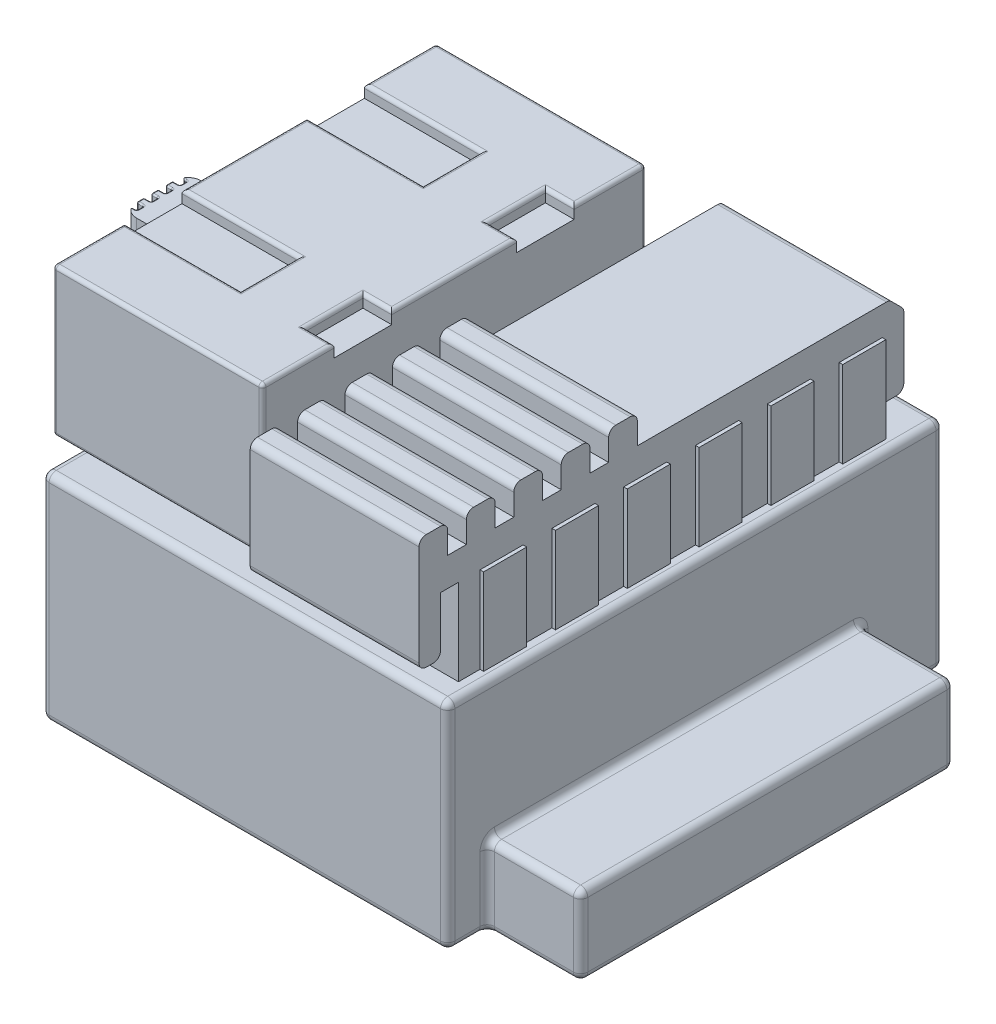
from build123d import *

# Parameters (mm, degrees)
SKETCH1_W           = 28.25
SKETCH1_H           = 34.5
BOSS_EXTRUDE1_DEPTH = 15
SKETCH1_3_W         = 6.5
SKETCH1_3_H         = 26
BOSS_EXTRUDE2_DEPTH = 5.5
SKETCH2_W           = 10.5
SKETCH2_H           = 25
BOSS_EXTRUDE3_DEPTH = 1
SKETCH3_W           = 14.6
SKETCH3_H           = 26.7
BOSS_EXTRUDE4_DEPTH = 10.3
SKETCH4_R           = 0.75
SKETCH4_W           = 9
SKETCH4_H           = 4
CUT_EXTRUDE1_DEPTH  = 2
SKETCH5_W           = 4.5
SKETCH5_H           = 4
BOSS_EXTRUDE5_DEPTH = 6
FILLET1_R           = 1
SKETCH6_W           = 1
SKETCH6_H           = 0.5
CUT_EXTRUDE2_DEPTH  = 6
FILLET4_R           = 0.1
SKETCH7_W           = 8.1
SKETCH7_H           = 4
SKETCH7_W_2         = 2
CUT_EXTRUDE3_DEPTH  = 0.85
FILLET6_R           = 0.25
FILLET7_R           = 0.5
SKETCH8_W           = 12.25
SKETCH8_H           = 3
BOSS_EXTRUDE6_DEPTH = 6
BOSS_EXTRUDE7_DEPTH = 11.75
FILLET8_R           = 0.5


with BuildPart() as part:
    # Sketch1 → Boss-Extrude1 (new body)
    with BuildSketch(Plane(origin=(0, 0, 0), x_dir=(1, 0, 0), z_dir=(0, 1, 0))):
        Rectangle(SKETCH1_W, SKETCH1_H)
    extrude(amount=BOSS_EXTRUDE1_DEPTH)

    # Sketch1<3> → Boss-Extrude2 (add)
    with BuildSketch(Plane(origin=(0, 0, 0), x_dir=(1, 0, 0), z_dir=(0, 1, 0))):
        with Locations((17.375, -1.5)):
            Rectangle(SKETCH1_3_W, SKETCH1_3_H)
    extrude(amount=BOSS_EXTRUDE2_DEPTH)

    # Sketch2 → Boss-Extrude3 (add)
    with BuildSketch(Plane(origin=(0, 15, 0), x_dir=(1, 0, 0), z_dir=(0, 1, 0))):
        with Locations((-6.875, -1.75)):
            Rectangle(SKETCH2_W, SKETCH2_H)
    extrude(amount=BOSS_EXTRUDE3_DEPTH)

    # Sketch3 → Boss-Extrude4 (add)
    with BuildSketch(Plane(origin=(0, 16, 0), x_dir=(1, 0, 0), z_dir=(0, 1, 0))):
        with Locations((-7.575, -2.4)):
            Rectangle(SKETCH3_W, SKETCH3_H)
    extrude(amount=BOSS_EXTRUDE4_DEPTH)

    # Sketch4 → Cut-Extrude1 (cut)
    with BuildSketch(Plane.ZY.offset(14.875)):
        with Locations((-7.45, 21.15)):
            Circle(SKETCH4_R)
        with Locations((12.25, 21.15)):
            Circle(SKETCH4_R)
        with Locations((2.4, 21.15)):
            Rectangle(SKETCH4_W, SKETCH4_H)
    extrude(amount=-CUT_EXTRUDE1_DEPTH, mode=Mode.SUBTRACT)

    # Sketch5 → Boss-Extrude5 (add)
    with BuildSketch(Plane.ZY.offset(12.875)):
        with Locations((4.65, 21.15)):
            Rectangle(SKETCH5_W, SKETCH5_H)
    extrude(amount=BOSS_EXTRUDE5_DEPTH)

    # Fillet1
    fillet1_edges = [part.edges().sort_by_distance(p)[0] for p in [
        (-18.875, 21.15, 6.9),
        (-18.875, 21.15, 2.4),
    ]]
    fillet(fillet1_edges, radius=FILLET1_R)

    # Sketch6 → Cut-Extrude2 (cut)
    with BuildSketch(Plane(origin=(0, 23.15, 0), x_dir=(1, 0, 0), z_dir=(0, 1, 0))):
        with Locations((-18.875, -3.15)):
            Rectangle(SKETCH6_W, SKETCH6_H)
        with Locations((-18.875, -4.15)):
            Rectangle(SKETCH6_W, SKETCH6_H)
        with Locations((-18.875, -5.15)):
            Rectangle(SKETCH6_W, SKETCH6_H)
        with Locations((-18.875, -6.15)):
            Rectangle(SKETCH6_W, SKETCH6_H)
    extrude(amount=-CUT_EXTRUDE2_DEPTH, mode=Mode.SUBTRACT)

    # Fillet4
    fillet4_edges = [part.edges().sort_by_distance(p)[0] for p in [
        (-18.741025404, 21.15, 2.9),
        (-18.375, 19.15, 3.15),
        (-18.375, 21.15, 2.9),
        (-18.558012702, 19.15, 2.9),
        (-18.625, 19.15, 3.4),
        (-18.375, 21.15, 3.4),
        (-18.625, 23.15, 3.4),
        (-18.375, 23.15, 3.15),
        (-18.558012702, 23.15, 2.9),
        (-18.875, 23.15, 3.65),
        (-18.875, 19.15, 4.65),
        (-18.875, 21.15, 4.4),
        (-18.875, 21.15, 3.9),
        (-18.375, 19.15, 4.15),
        (-18.375, 21.15, 3.9),
        (-18.625, 19.15, 3.9),
        (-18.625, 19.15, 4.4),
        (-18.375, 21.15, 4.4),
        (-18.625, 23.15, 3.9),
        (-18.625, 23.15, 4.4),
        (-18.375, 23.15, 4.15),
        (-18.875, 23.15, 4.65),
        (-18.875, 19.15, 5.65),
        (-18.875, 21.15, 5.4),
        (-18.875, 21.15, 4.9),
        (-18.375, 19.15, 5.15),
        (-18.375, 21.15, 4.9),
        (-18.625, 19.15, 4.9),
        (-18.625, 19.15, 5.4),
        (-18.375, 21.15, 5.4),
        (-18.625, 23.15, 4.9),
        (-18.625, 23.15, 5.4),
        (-18.375, 23.15, 5.15),
        (-18.741025404, 21.15, 6.4),
        (-18.375, 19.15, 6.15),
        (-18.375, 21.15, 5.9),
        (-18.625, 19.15, 5.9),
        (-18.558012702, 19.15, 6.4),
        (-18.375, 21.15, 6.4),
        (-18.558012702, 23.15, 6.4),
        (-18.375, 23.15, 6.15),
        (-18.625, 23.15, 5.9),
        (-18.875, 23.15, 5.65),
        (-18.875, 19.15, 3.65),
        (-18.875, 21.15, 5.9),
        (-18.875, 21.15, 3.4),
    ]]
    fillet(fillet4_edges, radius=FILLET4_R)

    # Sketch7 → Cut-Extrude3 (cut)
    with BuildSketch(Plane(origin=(0, 26.3, 0), x_dir=(1, 0, 0), z_dir=(0, 1, 0))):
        with Locations((-10.825, 3.95)):
            Rectangle(SKETCH7_W, SKETCH7_H)
        with Locations((-1.275, 3.95)):
            Rectangle(SKETCH7_W_2, SKETCH7_H)
        with Locations((-10.825, -8.75)):
            Rectangle(SKETCH7_W, SKETCH7_H)
        with Locations((-1.275, -8.75)):
            Rectangle(SKETCH7_W_2, SKETCH7_H)
    extrude(amount=-CUT_EXTRUDE3_DEPTH, mode=Mode.SUBTRACT)

    # Fillet6
    # the kernel refuses this fillet: 0.25 mm, written as the material it takes off along each edge
    with BuildSketch(Plane(origin=(-0.525, 26.05, 15.5), x_dir=(0, 0, 1), z_dir=(1, 0, 0))) as fillet6_piece_1_section:
        Polygon((0, 0), (FILLET6_R, 0), (FILLET6_R, -FILLET6_R), (0, -FILLET6_R), align=None)
    fillet6_piece_1 = extrude(amount=FILLET6_R, mode=Mode.PRIVATE)
    fillet6_piece_1 = fillet6_piece_1 - Plane(origin=(-0.525, 26.05, 15.5), x_dir=(0, -0.7071067811865475, -0.7071067811865475), z_dir=(1, 0, 0)) * Sphere(FILLET6_R, mode=Mode.PRIVATE)
    add(fillet6_piece_1, mode=Mode.SUBTRACT)
    with BuildSketch(Plane(origin=(-14.625, 26.05, 15.5), x_dir=(0, 1, 0), z_dir=(0, 0, 1))) as fillet6_piece_2_section:
        Polygon((0, 0), (FILLET6_R, 0), (FILLET6_R, FILLET6_R), (0, FILLET6_R), align=None)
    fillet6_piece_2 = extrude(amount=FILLET6_R, mode=Mode.PRIVATE)
    fillet6_piece_2 = fillet6_piece_2 - Plane(origin=(-14.625, 26.05, 15.5), x_dir=(0.7071067811865475, -0.7071067811865475, 0), z_dir=(0, 0, 1)) * Sphere(FILLET6_R, mode=Mode.PRIVATE)
    add(fillet6_piece_2, mode=Mode.SUBTRACT)
    with BuildSketch(Plane(origin=(-14.625, 26.05, -10.7), x_dir=(0, 1, 0), z_dir=(0, 0, -1))) as fillet6_piece_3_section:
        Polygon((0, 0), (FILLET6_R, 0), (FILLET6_R, -FILLET6_R), (0, -FILLET6_R), align=None)
    fillet6_piece_3 = extrude(amount=FILLET6_R, mode=Mode.PRIVATE)
    fillet6_piece_3 = fillet6_piece_3 - Plane(origin=(-14.625, 26.05, -10.7), x_dir=(0.7071067811865475, -0.7071067811865475, 0), z_dir=(0, 0, -1)) * Sphere(FILLET6_R, mode=Mode.PRIVATE)
    add(fillet6_piece_3, mode=Mode.SUBTRACT)
    with BuildSketch(Plane(origin=(-0.525, 26.05, -10.7), x_dir=(0, 0, -1), z_dir=(1, 0, 0))) as fillet6_piece_4_section:
        Polygon((0, 0), (FILLET6_R, 0), (FILLET6_R, FILLET6_R), (0, FILLET6_R), align=None)
    fillet6_piece_4 = extrude(amount=FILLET6_R, mode=Mode.PRIVATE)
    fillet6_piece_4 = fillet6_piece_4 - Plane(origin=(-0.525, 26.05, -10.7), x_dir=(0, -0.7071067811865475, 0.7071067811865475), z_dir=(1, 0, 0)) * Sphere(FILLET6_R, mode=Mode.PRIVATE)
    add(fillet6_piece_4, mode=Mode.SUBTRACT)
    with BuildSketch(Plane(origin=(-0.525, 16.25, -10.7), x_dir=(0, 0, -1), z_dir=(0, -1, 0))) as fillet6_piece_5_section:
        Polygon((0, 0), (FILLET6_R, 0), (FILLET6_R, FILLET6_R), (0, FILLET6_R), align=None)
    fillet6_piece_5 = extrude(amount=FILLET6_R, mode=Mode.PRIVATE)
    fillet6_piece_5 = fillet6_piece_5 - Plane(origin=(-0.525, 16.25, -10.7), x_dir=(-0.7071067811865475, 0, 0.7071067811865477), z_dir=(0, -1, 0)) * Sphere(FILLET6_R, mode=Mode.PRIVATE)
    add(fillet6_piece_5, mode=Mode.SUBTRACT)
    with BuildSketch(Plane(origin=(-14.625, 16.25, -10.7), x_dir=(0, 0, -1), z_dir=(0, -1, 0))) as fillet6_piece_6_section:
        Polygon((0, 0), (FILLET6_R, 0), (FILLET6_R, -FILLET6_R), (0, -FILLET6_R), align=None)
    fillet6_piece_6 = extrude(amount=FILLET6_R, mode=Mode.PRIVATE)
    fillet6_piece_6 = fillet6_piece_6 - Plane(origin=(-14.625, 16.25, -10.7), x_dir=(0.7071067811865476, 0, 0.7071067811865475), z_dir=(0, -1, 0)) * Sphere(FILLET6_R, mode=Mode.PRIVATE)
    add(fillet6_piece_6, mode=Mode.SUBTRACT)
    with BuildSketch(Plane(origin=(-14.625, 16.25, 15.5), x_dir=(0, 0, 1), z_dir=(0, -1, 0))) as fillet6_piece_7_section:
        Polygon((0, 0), (FILLET6_R, 0), (FILLET6_R, FILLET6_R), (0, FILLET6_R), align=None)
    fillet6_piece_7 = extrude(amount=FILLET6_R, mode=Mode.PRIVATE)
    fillet6_piece_7 = fillet6_piece_7 - Plane(origin=(-14.625, 16.25, 15.5), x_dir=(0.7071067811865475, 0, -0.7071067811865477), z_dir=(0, -1, 0)) * Sphere(FILLET6_R, mode=Mode.PRIVATE)
    add(fillet6_piece_7, mode=Mode.SUBTRACT)
    with BuildSketch(Plane(origin=(-0.525, 16.25, 15.5), x_dir=(0, 0, 1), z_dir=(0, -1, 0))) as fillet6_piece_8_section:
        Polygon((0, 0), (FILLET6_R, 0), (FILLET6_R, -FILLET6_R), (0, -FILLET6_R), align=None)
    fillet6_piece_8 = extrude(amount=FILLET6_R, mode=Mode.PRIVATE)
    fillet6_piece_8 = fillet6_piece_8 - Plane(origin=(-0.525, 16.25, 15.5), x_dir=(-0.7071067811865476, 0, -0.7071067811865475), z_dir=(0, -1, 0)) * Sphere(FILLET6_R, mode=Mode.PRIVATE)
    add(fillet6_piece_8, mode=Mode.SUBTRACT)
    with BuildSketch(Plane(origin=(-0.275, 26.3, 10.125), x_dir=(-1, 0, 0), z_dir=(0, 0, 1)), Plane(origin=(-0.275, 26.3, -10.7), x_dir=(-1, 0, 0), z_dir=(0, 0, 1))) as fillet6_piece_9:
        with BuildLine():
            CenterArc((FILLET6_R, FILLET6_R), FILLET6_R, 180, 90)
            Line((0, FILLET6_R), (0, 0))
            Line((0, 0), (FILLET6_R, 0))
        make_face()
    extrude(amount=5.375, mode=Mode.SUBTRACT)
    with BuildSketch(Plane(origin=(-0.525, 26.3, 15.75), x_dir=(0, 0, -1), z_dir=(-1, 0, 0))) as fillet6_piece_10:
        with BuildLine():
            CenterArc((FILLET6_R, FILLET6_R), FILLET6_R, 180, 90)
            Line((0, FILLET6_R), (0, 0))
            Line((0, 0), (FILLET6_R, 0))
        make_face()
    extrude(amount=14.1, mode=Mode.SUBTRACT)
    with BuildSketch(Plane(origin=(-14.875, 26.3, 15.5), x_dir=(0, -1, 0), z_dir=(0, 0, -1)), Plane(origin=(-14.875, 26.3, -5.325), x_dir=(0, -1, 0), z_dir=(0, 0, -1))) as fillet6_piece_11:
        with BuildLine():
            CenterArc((FILLET6_R, -FILLET6_R), FILLET6_R, 90, 90)
            Line((0, -FILLET6_R), (0, 0))
            Line((0, 0), (FILLET6_R, 0))
        make_face()
    extrude(amount=5.375, mode=Mode.SUBTRACT)
    with BuildSketch(Plane(origin=(-6.775, 26.3, 10.75), x_dir=(0, 0, 1), z_dir=(-1, 0, 0)), Plane(origin=(-15.5, 26.3, 6.75), x_dir=(0, 0, -1), z_dir=(1, 0, 0)), Plane(origin=(-6.775, 26.3, -1.95), x_dir=(0, 0, 1), z_dir=(-1, 0, 0)), Plane(origin=(-15.5, 26.3, -5.95), x_dir=(0, 0, -1), z_dir=(1, 0, 0))) as fillet6_piece_12:
        with BuildLine():
            CenterArc((FILLET6_R, -FILLET6_R), FILLET6_R, 90, 90)
            Line((0, -FILLET6_R), (0, 0))
            Line((0, 0), (FILLET6_R, 0))
        make_face()
    extrude(amount=8.725, mode=Mode.SUBTRACT)
    with BuildSketch(Plane(origin=(-6.775, 26.3, 6.75), x_dir=(1, 0, 0), z_dir=(0, 0, 1)), Plane(origin=(-6.775, 26.3, -5.95), x_dir=(1, 0, 0), z_dir=(0, 0, 1)), Plane(origin=(-2.275, 26.3, -1.95), x_dir=(-1, 0, 0), z_dir=(0, 0, -1)), Plane(origin=(-2.275, 26.3, 10.75), x_dir=(-1, 0, 0), z_dir=(0, 0, -1))) as fillet6_piece_13:
        with BuildLine():
            CenterArc((FILLET6_R, -FILLET6_R), FILLET6_R, 90, 90)
            Line((0, -FILLET6_R), (0, 0))
            Line((0, 0), (FILLET6_R, 0))
        make_face()
    extrude(amount=4, mode=Mode.SUBTRACT)
    with BuildSketch(Plane(origin=(-14.875, 26.3, 7.375), x_dir=(0, -1, 0), z_dir=(0, 0, -1))) as fillet6_piece_14:
        with BuildLine():
            CenterArc((FILLET6_R, -FILLET6_R), FILLET6_R, 90, 90)
            Line((0, -FILLET6_R), (0, 0))
            Line((0, 0), (FILLET6_R, 0))
        make_face()
    extrude(amount=9.95, mode=Mode.SUBTRACT)
    with BuildSketch(Plane(origin=(-14.625, 26.3, -10.95), x_dir=(0, -1, 0), z_dir=(1, 0, 0)), Plane(origin=(-0.525, 16, 15.75), x_dir=(0, 0, -1), z_dir=(-1, 0, 0))) as fillet6_piece_15:
        with BuildLine():
            CenterArc((FILLET6_R, -FILLET6_R), FILLET6_R, 90, 90)
            Line((0, -FILLET6_R), (0, 0))
            Line((0, 0), (FILLET6_R, 0))
        make_face()
    extrude(amount=14.1, mode=Mode.SUBTRACT)
    with BuildSketch(Plane(origin=(-2.275, 26.3, -5.95), x_dir=(0, 0, -1), z_dir=(1, 0, 0)), Plane(origin=(0.35, 26.3, -1.95), x_dir=(0, 0, 1), z_dir=(-1, 0, 0)), Plane(origin=(-2.275, 26.3, 6.75), x_dir=(0, 0, -1), z_dir=(1, 0, 0)), Plane(origin=(0.35, 26.3, 10.75), x_dir=(0, 0, 1), z_dir=(-1, 0, 0))) as fillet6_piece_16:
        with BuildLine():
            CenterArc((FILLET6_R, -FILLET6_R), FILLET6_R, 90, 90)
            Line((0, -FILLET6_R), (0, 0))
            Line((0, 0), (FILLET6_R, 0))
        make_face()
    extrude(amount=2.625, mode=Mode.SUBTRACT)
    with BuildSketch(Plane(origin=(-0.275, 26.3, -2.575), x_dir=(-1, 0, 0), z_dir=(0, 0, 1))) as fillet6_piece_17:
        with BuildLine():
            CenterArc((FILLET6_R, FILLET6_R), FILLET6_R, 180, 90)
            Line((0, FILLET6_R), (0, 0))
            Line((0, 0), (FILLET6_R, 0))
        make_face()
    extrude(amount=9.95, mode=Mode.SUBTRACT)
    with BuildSketch(Plane(origin=(-0.275, 16.25, -10.95), x_dir=(-1, 0, 0), z_dir=(0, 1, 0)), Plane(origin=(-14.875, 16.25, -10.95), x_dir=(0, 0, 1), z_dir=(0, 1, 0))) as fillet6_piece_18:
        with BuildLine():
            CenterArc((FILLET6_R, FILLET6_R), FILLET6_R, 180, 90)
            Line((0, FILLET6_R), (0, 0))
            Line((0, 0), (FILLET6_R, 0))
        make_face()
    extrude(amount=9.8, mode=Mode.SUBTRACT)
    with BuildSketch(Plane(origin=(-14.875, 16.25, 15.75), x_dir=(0, 0, -1), z_dir=(0, 1, 0)), Plane(origin=(-0.275, 16.25, 15.75), x_dir=(-1, 0, 0), z_dir=(0, 1, 0))) as fillet6_piece_19:
        with BuildLine():
            CenterArc((FILLET6_R, -FILLET6_R), FILLET6_R, 90, 90)
            Line((0, -FILLET6_R), (0, 0))
            Line((0, 0), (FILLET6_R, 0))
        make_face()
    extrude(amount=9.8, mode=Mode.SUBTRACT)
    with BuildSketch(Plane(origin=(-0.275, 16, -10.7), x_dir=(-1, 0, 0), z_dir=(0, 0, 1))) as fillet6_piece_20:
        with BuildLine():
            CenterArc((FILLET6_R, -FILLET6_R), FILLET6_R, 90, 90)
            Line((0, -FILLET6_R), (0, 0))
            Line((0, 0), (FILLET6_R, 0))
        make_face()
    extrude(amount=26.2, mode=Mode.SUBTRACT)
    with BuildSketch(Plane(origin=(-14.625, 16, -10.95), x_dir=(0, 0, 1), z_dir=(1, 0, 0))) as fillet6_piece_21_section:
        with BuildLine():
            CenterArc((FILLET6_R, -FILLET6_R), FILLET6_R, 90, 90)
            Line((0, -FILLET6_R), (0, 0))
            Line((0, 0), (FILLET6_R, 0))
        make_face()
    fillet6_piece_21 = extrude(amount=14.1, mode=Mode.PRIVATE)
    fillet6_piece_21 = split(fillet6_piece_21, bisect_by=Plane(origin=(-12.125, 15.998507735, -10.728145623), z_dir=(-1, 0, 0)), keep=Keep.TOP, mode=Mode.PRIVATE)
    fillet6_piece_21 = split(fillet6_piece_21, bisect_by=Plane(origin=(-13.375, 15.998507735, -10.75), z_dir=(0, 0, 1)), keep=Keep.TOP, mode=Mode.PRIVATE)
    add(fillet6_piece_21, mode=Mode.SUBTRACT)
    with BuildSketch(Plane(origin=(-14.625, 16, -10.95), x_dir=(0, 0, 1), z_dir=(1, 0, 0))) as fillet6_piece_22_section:
        with BuildLine():
            CenterArc((FILLET6_R, -FILLET6_R), FILLET6_R, 90, 90)
            Line((0, -FILLET6_R), (0, 0))
            Line((0, 0), (FILLET6_R, 0))
        make_face()
    fillet6_piece_22 = extrude(amount=14.1, mode=Mode.PRIVATE)
    fillet6_piece_22 = split(fillet6_piece_22, bisect_by=Plane(origin=(-12.125, 16.057841629, -10.896936842), z_dir=(-1, 0, 0)), keep=Keep.TOP, mode=Mode.PRIVATE)
    fillet6_piece_22 = split(fillet6_piece_22, bisect_by=Plane(origin=(-13.375, 16.057841629, -10.75), z_dir=(0, 0, -1)), keep=Keep.TOP, mode=Mode.PRIVATE)
    add(fillet6_piece_22, mode=Mode.SUBTRACT)
    with BuildSketch(Plane(origin=(-14.625, 16, -10.95), x_dir=(0, 0, 1), z_dir=(1, 0, 0))) as fillet6_piece_23_section:
        with BuildLine():
            CenterArc((FILLET6_R, -FILLET6_R), FILLET6_R, 90, 90)
            Line((0, -FILLET6_R), (0, 0))
            Line((0, 0), (FILLET6_R, 0))
        make_face()
    fillet6_piece_23 = extrude(amount=14.1, mode=Mode.PRIVATE)
    fillet6_piece_23 = split(fillet6_piece_23, bisect_by=Plane(origin=(-12.125, 16.057841629, -10.896936842), z_dir=(1, 0, 0)), keep=Keep.TOP, mode=Mode.PRIVATE)
    fillet6_piece_23 = split(fillet6_piece_23, bisect_by=Plane(origin=(-6.875, 16.057841629, -10.75), z_dir=(0, 0, -1)), keep=Keep.TOP, mode=Mode.PRIVATE)
    fillet6_piece_23 = split(fillet6_piece_23, bisect_by=Plane(origin=(-1.625, 16.057841629, -10.896936842), z_dir=(-1, 0, 0)), keep=Keep.TOP, mode=Mode.PRIVATE)
    add(fillet6_piece_23, mode=Mode.SUBTRACT)
    with BuildSketch(Plane(origin=(-14.625, 16, -10.95), x_dir=(0, 0, 1), z_dir=(1, 0, 0))) as fillet6_piece_24_section:
        with BuildLine():
            CenterArc((FILLET6_R, -FILLET6_R), FILLET6_R, 90, 90)
            Line((0, -FILLET6_R), (0, 0))
            Line((0, 0), (FILLET6_R, 0))
        make_face()
    fillet6_piece_24 = extrude(amount=14.1, mode=Mode.PRIVATE)
    fillet6_piece_24 = split(fillet6_piece_24, bisect_by=Plane(origin=(-1.075, 15.998507735, -10.75), z_dir=(0, 0, 1)), keep=Keep.TOP, mode=Mode.PRIVATE)
    fillet6_piece_24 = split(fillet6_piece_24, bisect_by=Plane(origin=(-1.625, 15.998507735, -10.728145623), z_dir=(1, 0, 0)), keep=Keep.TOP, mode=Mode.PRIVATE)
    add(fillet6_piece_24, mode=Mode.SUBTRACT)
    with BuildSketch(Plane(origin=(-14.625, 16, -10.95), x_dir=(0, 0, 1), z_dir=(1, 0, 0))) as fillet6_piece_25_section:
        with BuildLine():
            CenterArc((FILLET6_R, -FILLET6_R), FILLET6_R, 90, 90)
            Line((0, -FILLET6_R), (0, 0))
            Line((0, 0), (FILLET6_R, 0))
        make_face()
    fillet6_piece_25 = extrude(amount=14.1, mode=Mode.PRIVATE)
    fillet6_piece_25 = split(fillet6_piece_25, bisect_by=Plane(origin=(-1.075, 16.057841629, -10.75), z_dir=(0, 0, -1)), keep=Keep.TOP, mode=Mode.PRIVATE)
    fillet6_piece_25 = split(fillet6_piece_25, bisect_by=Plane(origin=(-1.625, 16.057841629, -10.896936842), z_dir=(1, 0, 0)), keep=Keep.TOP, mode=Mode.PRIVATE)
    add(fillet6_piece_25, mode=Mode.SUBTRACT)
    with BuildSketch(Plane(origin=(-14.875, 16, 15.5), x_dir=(0, 1, 0), z_dir=(0, 0, -1))) as fillet6_piece_26:
        with BuildLine():
            CenterArc((FILLET6_R, FILLET6_R), FILLET6_R, 180, 90)
            Line((0, FILLET6_R), (0, 0))
            Line((0, 0), (FILLET6_R, 0))
        make_face()
    extrude(amount=26.2, mode=Mode.SUBTRACT)
    with BuildSketch(Plane(origin=(-6.775, 26.3, 6.75), x_dir=(1, 0, 0), z_dir=(0, 0, 1))) as fillet6_piece_27a_section:
        with BuildLine():
            CenterArc((FILLET6_R, -FILLET6_R), FILLET6_R, 90, 90)
            Line((0, -FILLET6_R), (0, 0))
            Line((0, 0), (FILLET6_R, 0))
        make_face()
    fillet6_piece_27a = extrude(amount=4.625, mode=Mode.PRIVATE)
    fillet6_piece_27a = split(fillet6_piece_27a, bisect_by=Plane(origin=(-6.718401221, 26.243401221, 10.75), z_dir=(0, 0, 1)), keep=Keep.TOP, mode=Mode.PRIVATE)
    with BuildSketch(Plane(origin=(-6.15, 26.3, 10.75), x_dir=(0, 0, 1), z_dir=(-1, 0, 0))) as fillet6_piece_27b_section:
        with BuildLine():
            CenterArc((FILLET6_R, -FILLET6_R), FILLET6_R, 90, 90)
            Line((0, -FILLET6_R), (0, 0))
            Line((0, 0), (FILLET6_R, 0))
        make_face()
    fillet6_piece_27b = extrude(amount=9.35, mode=Mode.PRIVATE)
    fillet6_piece_27b = split(fillet6_piece_27b, bisect_by=Plane(origin=(-6.775, 26.243401221, 10.806598779), z_dir=(1, 0, 0)), keep=Keep.TOP, mode=Mode.PRIVATE)
    fillet6_piece_27 = fillet6_piece_27a & fillet6_piece_27b
    add(fillet6_piece_27, mode=Mode.SUBTRACT)
    with BuildSketch(Plane(origin=(-15.5, 26.3, 6.75), x_dir=(0, 0, -1), z_dir=(1, 0, 0))) as fillet6_piece_28a_section:
        with BuildLine():
            CenterArc((FILLET6_R, -FILLET6_R), FILLET6_R, 90, 90)
            Line((0, -FILLET6_R), (0, 0))
            Line((0, 0), (FILLET6_R, 0))
        make_face()
    fillet6_piece_28a = extrude(amount=9.35, mode=Mode.PRIVATE)
    fillet6_piece_28a = split(fillet6_piece_28a, bisect_by=Plane(origin=(-6.775, 26.243401221, 6.693401221), z_dir=(1, 0, 0)), keep=Keep.TOP, mode=Mode.PRIVATE)
    with BuildSketch(Plane(origin=(-6.775, 26.3, 6.125), x_dir=(1, 0, 0), z_dir=(0, 0, 1))) as fillet6_piece_28b_section:
        with BuildLine():
            CenterArc((FILLET6_R, -FILLET6_R), FILLET6_R, 90, 90)
            Line((0, -FILLET6_R), (0, 0))
            Line((0, 0), (FILLET6_R, 0))
        make_face()
    fillet6_piece_28b = extrude(amount=4.625, mode=Mode.PRIVATE)
    fillet6_piece_28b = split(fillet6_piece_28b, bisect_by=Plane(origin=(-6.718401221, 26.243401221, 6.75), z_dir=(0, 0, -1)), keep=Keep.TOP, mode=Mode.PRIVATE)
    fillet6_piece_28 = fillet6_piece_28a & fillet6_piece_28b
    add(fillet6_piece_28, mode=Mode.SUBTRACT)
    with BuildSketch(Plane(origin=(-6.775, 26.3, -5.95), x_dir=(1, 0, 0), z_dir=(0, 0, 1))) as fillet6_piece_29a_section:
        with BuildLine():
            CenterArc((FILLET6_R, -FILLET6_R), FILLET6_R, 90, 90)
            Line((0, -FILLET6_R), (0, 0))
            Line((0, 0), (FILLET6_R, 0))
        make_face()
    fillet6_piece_29a = extrude(amount=4.625, mode=Mode.PRIVATE)
    fillet6_piece_29a = split(fillet6_piece_29a, bisect_by=Plane(origin=(-6.718401221, 26.243401221, -1.95), z_dir=(0, 0, 1)), keep=Keep.TOP, mode=Mode.PRIVATE)
    with BuildSketch(Plane(origin=(-6.15, 26.3, -1.95), x_dir=(0, 0, 1), z_dir=(-1, 0, 0))) as fillet6_piece_29b_section:
        with BuildLine():
            CenterArc((FILLET6_R, -FILLET6_R), FILLET6_R, 90, 90)
            Line((0, -FILLET6_R), (0, 0))
            Line((0, 0), (FILLET6_R, 0))
        make_face()
    fillet6_piece_29b = extrude(amount=9.35, mode=Mode.PRIVATE)
    fillet6_piece_29b = split(fillet6_piece_29b, bisect_by=Plane(origin=(-6.775, 26.243401221, -1.893401221), z_dir=(1, 0, 0)), keep=Keep.TOP, mode=Mode.PRIVATE)
    fillet6_piece_29 = fillet6_piece_29a & fillet6_piece_29b
    add(fillet6_piece_29, mode=Mode.SUBTRACT)
    with BuildSketch(Plane(origin=(-15.5, 26.3, -5.95), x_dir=(0, 0, -1), z_dir=(1, 0, 0))) as fillet6_piece_30a_section:
        with BuildLine():
            CenterArc((FILLET6_R, -FILLET6_R), FILLET6_R, 90, 90)
            Line((0, -FILLET6_R), (0, 0))
            Line((0, 0), (FILLET6_R, 0))
        make_face()
    fillet6_piece_30a = extrude(amount=9.35, mode=Mode.PRIVATE)
    fillet6_piece_30a = split(fillet6_piece_30a, bisect_by=Plane(origin=(-6.775, 26.243401221, -6.006598779), z_dir=(1, 0, 0)), keep=Keep.TOP, mode=Mode.PRIVATE)
    with BuildSketch(Plane(origin=(-6.775, 26.3, -6.575), x_dir=(1, 0, 0), z_dir=(0, 0, 1))) as fillet6_piece_30b_section:
        with BuildLine():
            CenterArc((FILLET6_R, -FILLET6_R), FILLET6_R, 90, 90)
            Line((0, -FILLET6_R), (0, 0))
            Line((0, 0), (FILLET6_R, 0))
        make_face()
    fillet6_piece_30b = extrude(amount=4.625, mode=Mode.PRIVATE)
    fillet6_piece_30b = split(fillet6_piece_30b, bisect_by=Plane(origin=(-6.718401221, 26.243401221, -5.95), z_dir=(0, 0, -1)), keep=Keep.TOP, mode=Mode.PRIVATE)
    fillet6_piece_30 = fillet6_piece_30a & fillet6_piece_30b
    add(fillet6_piece_30, mode=Mode.SUBTRACT)
    with BuildSketch(Plane(origin=(-2.275, 26.3, -1.95), x_dir=(-1, 0, 0), z_dir=(0, 0, -1))) as fillet6_piece_31a_section:
        with BuildLine():
            CenterArc((FILLET6_R, -FILLET6_R), FILLET6_R, 90, 90)
            Line((0, -FILLET6_R), (0, 0))
            Line((0, 0), (FILLET6_R, 0))
        make_face()
    fillet6_piece_31a = extrude(amount=4.625, mode=Mode.PRIVATE)
    fillet6_piece_31a = split(fillet6_piece_31a, bisect_by=Plane(origin=(-2.331598779, 26.243401221, -5.95), z_dir=(0, 0, -1)), keep=Keep.TOP, mode=Mode.PRIVATE)
    with BuildSketch(Plane(origin=(-2.9, 26.3, -5.95), x_dir=(0, 0, -1), z_dir=(1, 0, 0))) as fillet6_piece_31b_section:
        with BuildLine():
            CenterArc((FILLET6_R, -FILLET6_R), FILLET6_R, 90, 90)
            Line((0, -FILLET6_R), (0, 0))
            Line((0, 0), (FILLET6_R, 0))
        make_face()
    fillet6_piece_31b = extrude(amount=3.25, mode=Mode.PRIVATE)
    fillet6_piece_31b = split(fillet6_piece_31b, bisect_by=Plane(origin=(-2.275, 26.243401221, -6.006598779), z_dir=(-1, 0, 0)), keep=Keep.TOP, mode=Mode.PRIVATE)
    fillet6_piece_31 = fillet6_piece_31a & fillet6_piece_31b
    add(fillet6_piece_31, mode=Mode.SUBTRACT)
    with BuildSketch(Plane(origin=(0.35, 26.3, -1.95), x_dir=(0, 0, 1), z_dir=(-1, 0, 0))) as fillet6_piece_32a_section:
        with BuildLine():
            CenterArc((FILLET6_R, -FILLET6_R), FILLET6_R, 90, 90)
            Line((0, -FILLET6_R), (0, 0))
            Line((0, 0), (FILLET6_R, 0))
        make_face()
    fillet6_piece_32a = extrude(amount=3.25, mode=Mode.PRIVATE)
    fillet6_piece_32a = split(fillet6_piece_32a, bisect_by=Plane(origin=(-2.275, 26.243401221, -1.893401221), z_dir=(-1, 0, 0)), keep=Keep.TOP, mode=Mode.PRIVATE)
    with BuildSketch(Plane(origin=(-2.275, 26.3, -1.325), x_dir=(-1, 0, 0), z_dir=(0, 0, -1))) as fillet6_piece_32b_section:
        with BuildLine():
            CenterArc((FILLET6_R, -FILLET6_R), FILLET6_R, 90, 90)
            Line((0, -FILLET6_R), (0, 0))
            Line((0, 0), (FILLET6_R, 0))
        make_face()
    fillet6_piece_32b = extrude(amount=4.625, mode=Mode.PRIVATE)
    fillet6_piece_32b = split(fillet6_piece_32b, bisect_by=Plane(origin=(-2.331598779, 26.243401221, -1.95), z_dir=(0, 0, 1)), keep=Keep.TOP, mode=Mode.PRIVATE)
    fillet6_piece_32 = fillet6_piece_32a & fillet6_piece_32b
    add(fillet6_piece_32, mode=Mode.SUBTRACT)
    with BuildSketch(Plane(origin=(-2.275, 26.3, 10.75), x_dir=(-1, 0, 0), z_dir=(0, 0, -1))) as fillet6_piece_33a_section:
        with BuildLine():
            CenterArc((FILLET6_R, -FILLET6_R), FILLET6_R, 90, 90)
            Line((0, -FILLET6_R), (0, 0))
            Line((0, 0), (FILLET6_R, 0))
        make_face()
    fillet6_piece_33a = extrude(amount=4.625, mode=Mode.PRIVATE)
    fillet6_piece_33a = split(fillet6_piece_33a, bisect_by=Plane(origin=(-2.331598779, 26.243401221, 6.75), z_dir=(0, 0, -1)), keep=Keep.TOP, mode=Mode.PRIVATE)
    with BuildSketch(Plane(origin=(-2.9, 26.3, 6.75), x_dir=(0, 0, -1), z_dir=(1, 0, 0))) as fillet6_piece_33b_section:
        with BuildLine():
            CenterArc((FILLET6_R, -FILLET6_R), FILLET6_R, 90, 90)
            Line((0, -FILLET6_R), (0, 0))
            Line((0, 0), (FILLET6_R, 0))
        make_face()
    fillet6_piece_33b = extrude(amount=3.25, mode=Mode.PRIVATE)
    fillet6_piece_33b = split(fillet6_piece_33b, bisect_by=Plane(origin=(-2.275, 26.243401221, 6.693401221), z_dir=(-1, 0, 0)), keep=Keep.TOP, mode=Mode.PRIVATE)
    fillet6_piece_33 = fillet6_piece_33a & fillet6_piece_33b
    add(fillet6_piece_33, mode=Mode.SUBTRACT)
    with BuildSketch(Plane(origin=(0.35, 26.3, 10.75), x_dir=(0, 0, 1), z_dir=(-1, 0, 0))) as fillet6_piece_34a_section:
        with BuildLine():
            CenterArc((FILLET6_R, -FILLET6_R), FILLET6_R, 90, 90)
            Line((0, -FILLET6_R), (0, 0))
            Line((0, 0), (FILLET6_R, 0))
        make_face()
    fillet6_piece_34a = extrude(amount=3.25, mode=Mode.PRIVATE)
    fillet6_piece_34a = split(fillet6_piece_34a, bisect_by=Plane(origin=(-2.275, 26.243401221, 10.806598779), z_dir=(-1, 0, 0)), keep=Keep.TOP, mode=Mode.PRIVATE)
    with BuildSketch(Plane(origin=(-2.275, 26.3, 11.375), x_dir=(-1, 0, 0), z_dir=(0, 0, -1))) as fillet6_piece_34b_section:
        with BuildLine():
            CenterArc((FILLET6_R, -FILLET6_R), FILLET6_R, 90, 90)
            Line((0, -FILLET6_R), (0, 0))
            Line((0, 0), (FILLET6_R, 0))
        make_face()
    fillet6_piece_34b = extrude(amount=4.625, mode=Mode.PRIVATE)
    fillet6_piece_34b = split(fillet6_piece_34b, bisect_by=Plane(origin=(-2.331598779, 26.243401221, 10.75), z_dir=(0, 0, 1)), keep=Keep.TOP, mode=Mode.PRIVATE)
    fillet6_piece_34 = fillet6_piece_34a & fillet6_piece_34b
    add(fillet6_piece_34, mode=Mode.SUBTRACT)

    # Fillet7
    fillet7_edges = [part.edges().sort_by_distance(p)[0] for p in [
        (0, 15, -17.25),
        (14.125, 0, -14.375),
        (20.625, 5.5, 1.5),
        (20.625, 2.75, 14.5),
        (17.375, 5.5, -11.5),
        (20.625, 2.75, -11.5),
        (14.125, 5.5, 1.5),
        (-14.125, 15, 0),
        (14.125, 2.75, -11.5),
        (17.375, 0, 14.5),
        (14.125, 2.75, 14.5),
        (17.375, 5.5, 14.5),
        (20.625, 0, 1.5),
        (17.375, 0, -11.5),
        (0, 15, 17.25),
        (-14.125, 0, 0),
        (0, 0, -17.25),
        (14.125, 0, 15.875),
        (0, 0, 17.25),
        (-14.125, 7.5, 17.25),
        (-14.125, 7.5, -17.25),
        (14.125, 7.5, -17.25),
        (14.125, 15, 0),
        (14.125, 7.5, 17.25),
    ]]
    fillet(fillet7_edges, radius=FILLET7_R)

    # Sketch8 → Boss-Extrude6 (add)
    with BuildSketch(Plane(origin=(0, 15, 0), x_dir=(1, 0, 0), z_dir=(0, 1, 0))):
        with Locations((7.25, 12.5)):
            Rectangle(SKETCH8_W, SKETCH8_H)
        with Locations((7.25, 7.5)):
            Rectangle(SKETCH8_W, SKETCH8_H)
        with Locations((7.25, 2.5)):
            Rectangle(SKETCH8_W, SKETCH8_H)
        with Locations((7.25, -2.5)):
            Rectangle(SKETCH8_W, SKETCH8_H)
        with Locations((7.25, -7.5)):
            Rectangle(SKETCH8_W, SKETCH8_H)
        with Locations((7.25, -12.5)):
            Rectangle(SKETCH8_W, SKETCH8_H)
    extrude(amount=BOSS_EXTRUDE6_DEPTH)

    # Sketch9 → Boss-Extrude7 (add)
    with BuildSketch(Plane(origin=(13.125, 0, 0), x_dir=(0, 0, -1), z_dir=(1, 0, 0))):
        Polygon((-14, 15), (-14, 21), (-11, 21), (-11, 15), (-9, 15), (-9, 21), (-6, 21), (-6, 15), (-4, 15), (-4, 21), (-1, 21), (-1, 15), (1, 15), (1, 21), (4, 21), (4, 15), (6, 15), (6, 21), (9, 21), (9, 15), (11, 15), (11, 21), (14, 21), (14, 17), (15.5, 17), (15.5, 22), (14.5, 23), (-3.05, 23), (-3.05, 25), (-5.05, 25), (-5.05, 23), (-6.35, 23), (-6.35, 25), (-8.35, 25), (-8.35, 23), (-9.65, 23), (-9.65, 25), (-11.65, 25), (-11.65, 23), (-12.95, 23), (-12.95, 25), (-14.95, 25), (-14.95, 23), (-16.25, 23), (-16.25, 25), (-18.25, 25), (-18.25, 17), (-16.75, 17), (-16.75, 21), (-15.5, 21), (-15.5, 15), align=None)
    extrude(amount=-BOSS_EXTRUDE7_DEPTH)

    # Fillet8
    fillet8_edges = [part.edges().sort_by_distance(p)[0] for p in [
        (7.25, 17, 16.75),
        (7.25, 17, 18.25),
        (7.25, 25, 18.25),
        (7.25, 25, 16.25),
        (7.25, 25, 14.95),
        (7.25, 25, 12.95),
        (7.25, 25, 11.65),
        (7.25, 25, 9.65),
        (7.25, 25, 8.35),
        (7.25, 25, 6.35),
        (7.25, 25, 5.05),
        (7.25, 25, 3.05),
        (7.25, 23, -14.5),
        (7.25, 22, -15.5),
        (7.25, 17, -15.5),
    ]]
    fillet(fillet8_edges, radius=FILLET8_R)


solid = part.part
